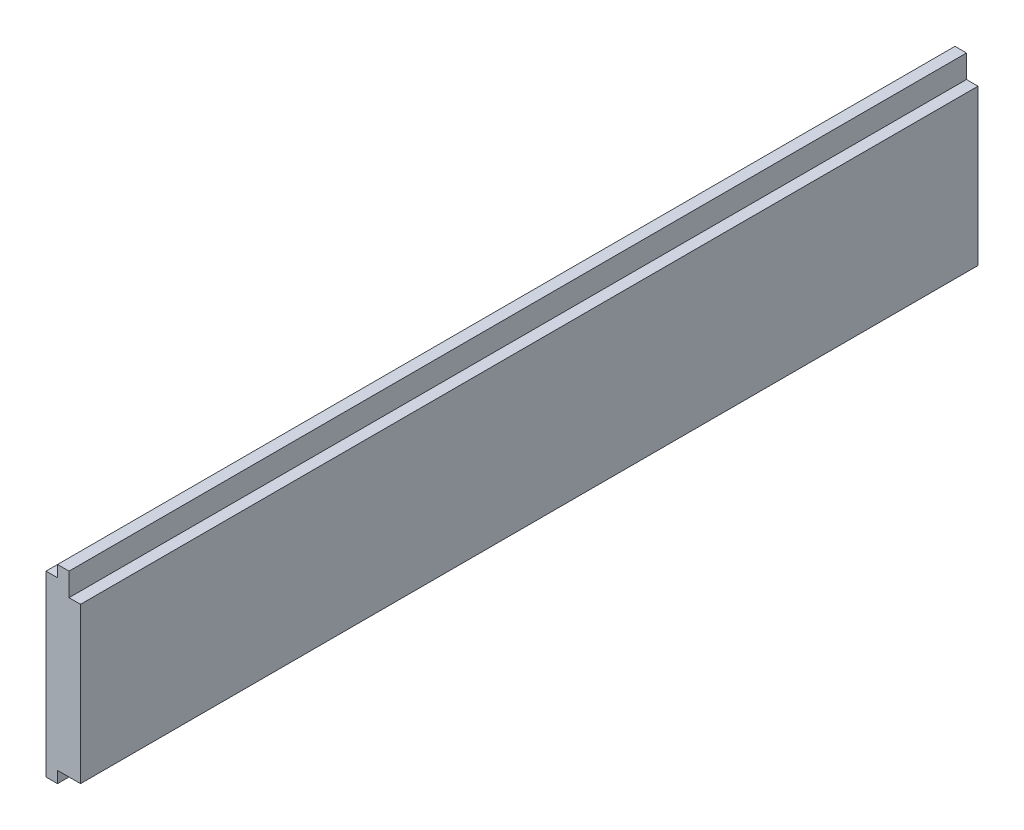
from build123d import *

# Parameters (mm, degrees)
EXTRUDE_1_DEPTH = 780


with BuildPart() as part:
    # Эскиз1 → Бобышка-Вытянуть1 (new body)
    with BuildSketch(Plane.XY):
        Polygon((0, 0), (0, 155), (10, 155), (10, 165), (20, 165), (20, 145), (30, 145), (30, 10), (10, 10), (10, 0), align=None)
    extrude(amount=EXTRUDE_1_DEPTH)


solid = part.part
